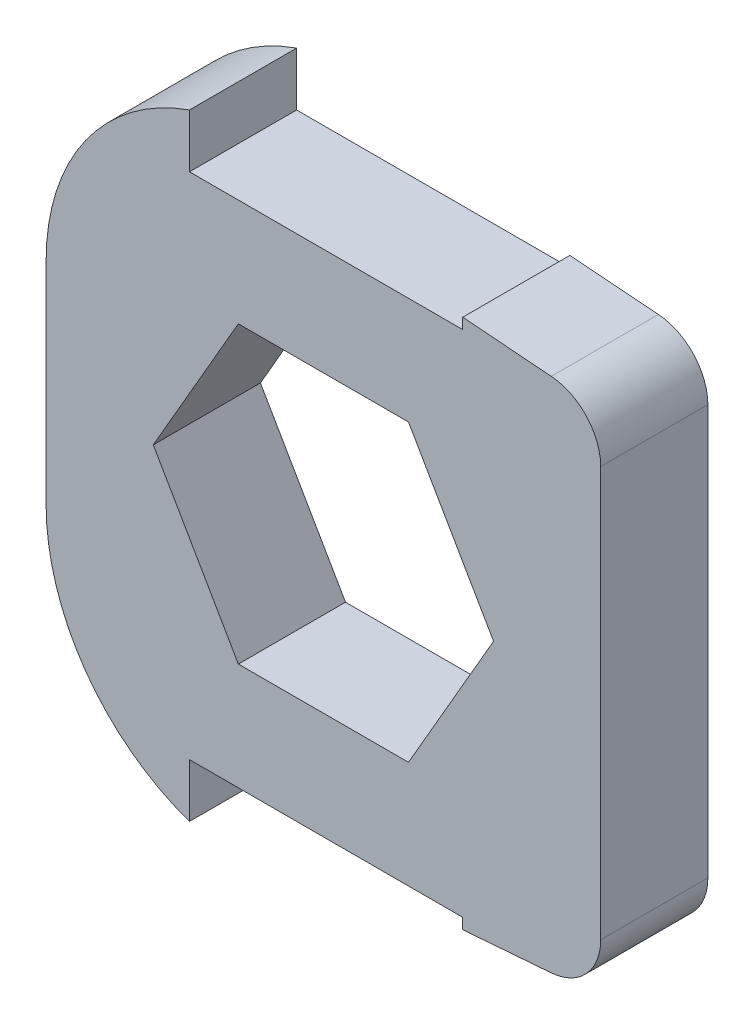
from build123d import *

# Parameters (mm, degrees)
BOSS_EXTRU_1_DEPTH = 2
CONG_1_R           = 4
CONG_2_R           = 1


with BuildPart() as part:
    # Esquisse1 → Boss.-Extru.1 (new body)
    with BuildSketch(Plane.XY):
        Polygon((0, 5.75), (2.675426481, 5.75), (2.675426481, 4.75), (7.775426481, 4.75), (7.775426481, 4.95), (10.350852961, 4.75), (10.350852961, -4.75), (7.775426481, -4.95), (7.775426481, -4.75), (2.675426481, -4.75), (2.675426481, -5.75), (0, -5.75), align=None)
        Polygon((2, 0), (3.58771324, -2.75), (6.763139721, -2.75), (8.350852961, 0), (6.763139721, 2.75), (3.58771324, 2.75), align=None, mode=Mode.SUBTRACT)
    extrude(amount=BOSS_EXTRU_1_DEPTH)

    # Congé1
    # the kernel refuses this fillet: 4 mm, written as the material it takes off along each edge
    with BuildSketch(Plane(origin=(0, -5.75, -9.435804481), x_dir=(1, 0, 0), z_dir=(0, 0, 1))) as cong_1_piece_1:
        with BuildLine():
            CenterArc((4, 3.774321792), CONG_1_R, 180, 70.661811314)
            Line((0, 3.774321792), (-0.08, 3.774321792))
            Line((-0.08, 3.774321792), (-0.08, 0))
            Line((-0.08, 0), (0, -0.08))
            ThreePointArc((0, -0.08), (1.33771324, -0.08), (2.64893501, -0.075486436))
            Line((2.64893501, -0.075486436), (2.675426481, 0))
        make_face()
    extrude(amount=20.871608961, mode=Mode.SUBTRACT)
    with BuildSketch(Plane(origin=(0, 5.75, -9.435804481), x_dir=(1, 0, 0), z_dir=(0, 0, 1))) as cong_1_piece_2:
        with BuildLine():
            CenterArc((4, -3.774321792), CONG_1_R, 109.338188686, 70.661811314)
            Line((0, -3.774321792), (-0.08, -3.774321792))
            Line((-0.08, -3.774321792), (-0.08, 0))
            Line((-0.08, 0), (0, 0.08))
            ThreePointArc((0, 0.08), (1.33771324, 0.08), (2.64893501, 0.075486436))
            Line((2.64893501, 0.075486436), (2.675426481, 0))
        make_face()
    extrude(amount=20.871608961, mode=Mode.SUBTRACT)

    # Congé2
    cong_2_edges = [part.edges().sort_by_distance(p)[0] for p in [
        (10.350852961, 4.75, 1),
        (10.350852961, -4.75, 1),
    ]]
    fillet(cong_2_edges, radius=CONG_2_R)


solid = part.part
